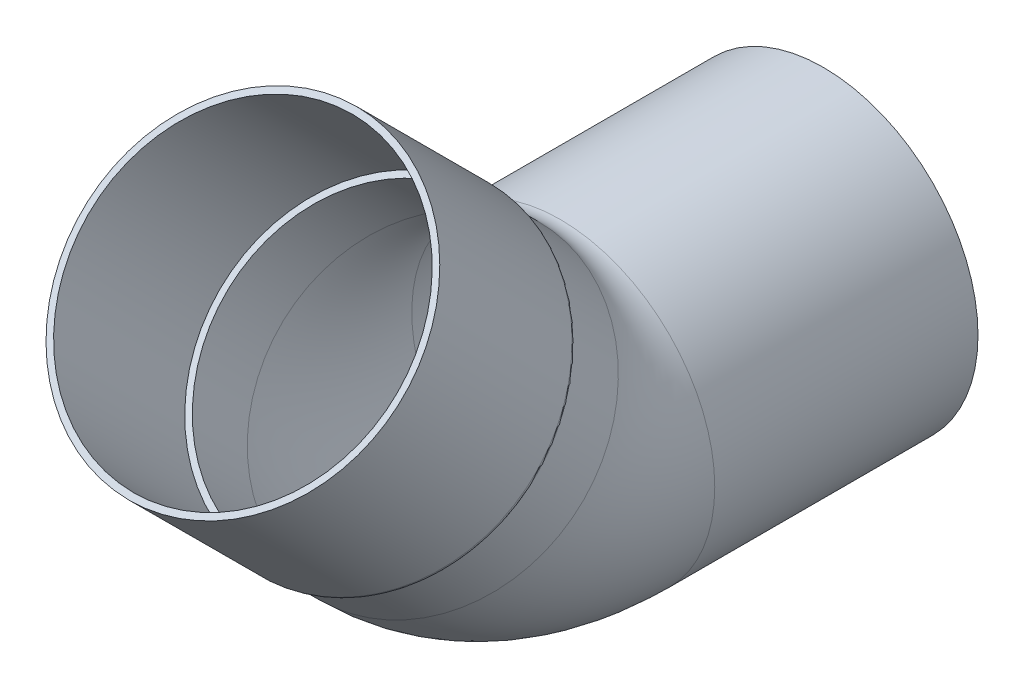
from build123d import *

# Parameters (mm, degrees)
ESQUISSE6_R        = 25
ESQUISSE6_R_2      = 24
ESQUISSE8_R        = 26
ESQUISSE8_R_2      = 24
EXTRU_MINCE1_DEPTH = 1
EXTRU_MINCE2_START = 30
ESQUISSE9_R        = 26
ESQUISSE9_R_2      = 25
EXTRU_MINCE2_DEPTH = 30
CONG_1_R           = 1
CONG_2_R           = 1


with BuildPart() as part:
    # Balayage-Mince2: sweep along a path in Esquisse7
    with BuildLine(Plane(origin=(0, 0, 0), x_dir=(0, 0, -1), z_dir=(1, 0, 0))) as balayage_mince2_path:
        Line((0, 0), (-42.573593129, 0))
        ThreePointArc((-42.573593129, 0), (-54.0540961, 2.283614025), (-63.786796564, 8.786796564))
        Line((-63.786796564, 8.786796564), (-71.970562748, 16.970562748))
    # Esquisse6 → Balayage-Mince2 (sweep)
    with BuildSketch(Plane.XY):
        Circle(ESQUISSE6_R)
        Circle(ESQUISSE6_R_2, mode=Mode.SUBTRACT)
    sweep(path=balayage_mince2_path.line)



with BuildPart() as body_2:
    # Esquisse8 → Extru.-Mince1 (new body)
    with BuildSketch(Plane(origin=(0, 44.470562748, 44.470562748), x_dir=(1, 0, 0), z_dir=(0, 0.7071067811865487, 0.7071067811865464))):
        with Locations((0, -38.890872965)):
            Circle(ESQUISSE8_R)
        with Locations((0, -38.890872965)):
            Circle(ESQUISSE8_R_2, mode=Mode.SUBTRACT)
    extrude(amount=EXTRU_MINCE1_DEPTH)


with BuildPart() as part_1:
    add(part.part)

    add(body_2.part)  # Extru.-Mince2 merges body 2
    # Esquisse9 → Extru.-Mince2 (add)
    with BuildSketch(Plane(origin=(0, 45.17766953, 45.17766953), x_dir=(1, 0, 0), z_dir=(0, 0.7071067811865487, 0.7071067811865464)).offset(EXTRU_MINCE2_START)):
        with Locations((0, -38.890872965)):
            Circle(ESQUISSE9_R)
        with Locations((0, -38.890872965)):
            Circle(ESQUISSE9_R_2, mode=Mode.SUBTRACT)
    extrude(amount=-EXTRU_MINCE2_DEPTH)

    # Congé1
    cong_1_edges = [part_1.edges().sort_by_distance(p)[0] for p in [
        (-25, 16.970562748, 71.970562748),
    ]]
    fillet(cong_1_edges, radius=CONG_1_R - 0.0001)  # a hair under: the kernel refuses the full size

    # Congé2
    cong_2_edges = [part_1.edges().sort_by_distance(p)[0] for p in [
        (-26, 16.970562748, 71.970562748),
    ]]
    fillet(cong_2_edges, radius=CONG_2_R)


solid = part_1.part
